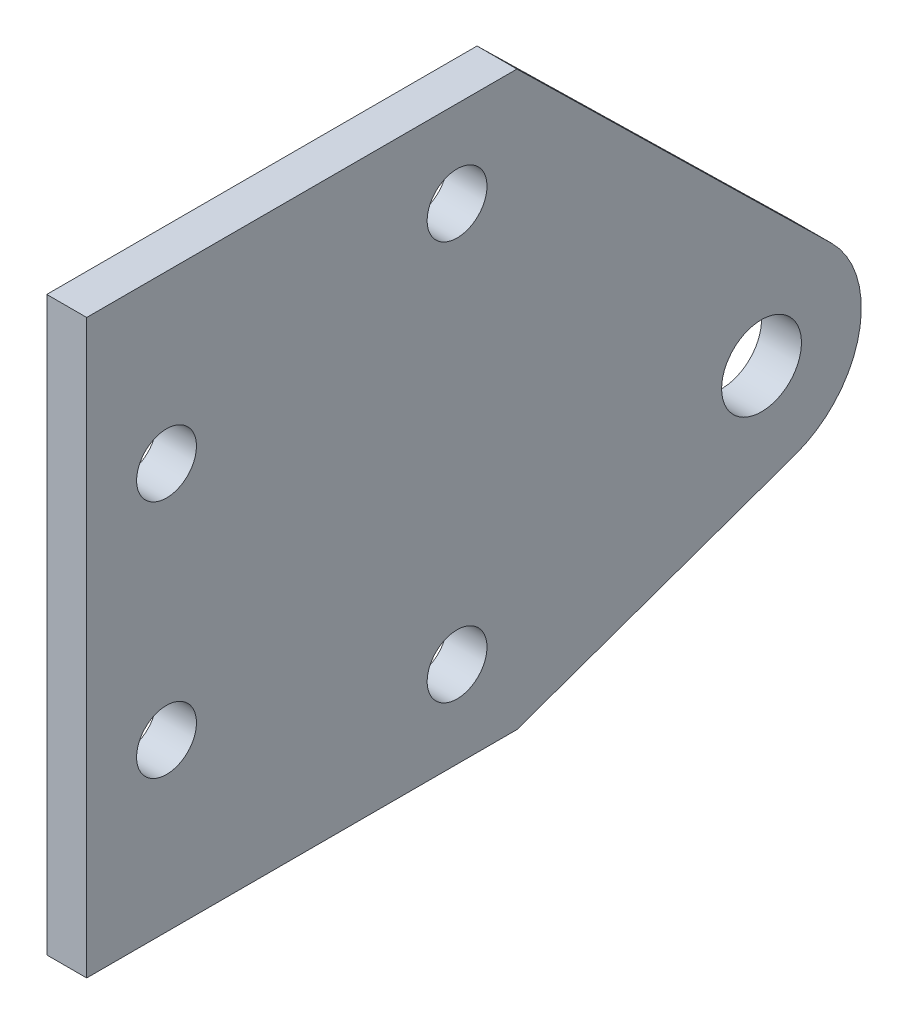
from build123d import *

# Parameters (mm, degrees)
SKETCH1_R           = 3.175
SKETCH1_R_2         = 2.38125
BOSS_EXTRUDE1_DEPTH = 3.175


with BuildPart() as part:
    # Sketch1 → Boss-Extrude1 (new body)
    with BuildSketch(Plane.ZY.offset(25.4)):
        with BuildLine():
            Line((-110.608164688, 341.71900808), (-88.4975, 333.860683619))
            Line((-88.4975, 333.860683619), (-54.275, 333.860683619))
            Line((-54.275, 333.860683619), (-54.275, 379.360683619))
            Line((-54.275, 379.360683619), (-88.4975, 379.360683619))
            Line((-88.4975, 379.360683619), (-113.503995941, 354.868900976))
            ThreePointArc((-113.503995941, 354.868900976), (-115.701762144, 347.491113055), (-110.608164688, 341.71900808))
        make_face()
        with Locations((-107.95, 349.198183619)):
            Circle(SKETCH1_R, mode=Mode.SUBTRACT)
        with Locations((-60.625, 366.135683619)):
            Circle(SKETCH1_R_2, mode=Mode.SUBTRACT)
        with Locations((-83.735, 372.485683619)):
            Circle(SKETCH1_R_2, mode=Mode.SUBTRACT)
        with Locations((-83.735, 340.735683619)):
            Circle(SKETCH1_R_2, mode=Mode.SUBTRACT)
        with Locations((-60.625, 347.085683619)):
            Circle(SKETCH1_R_2, mode=Mode.SUBTRACT)
    extrude(amount=BOSS_EXTRUDE1_DEPTH)


solid = part.part
